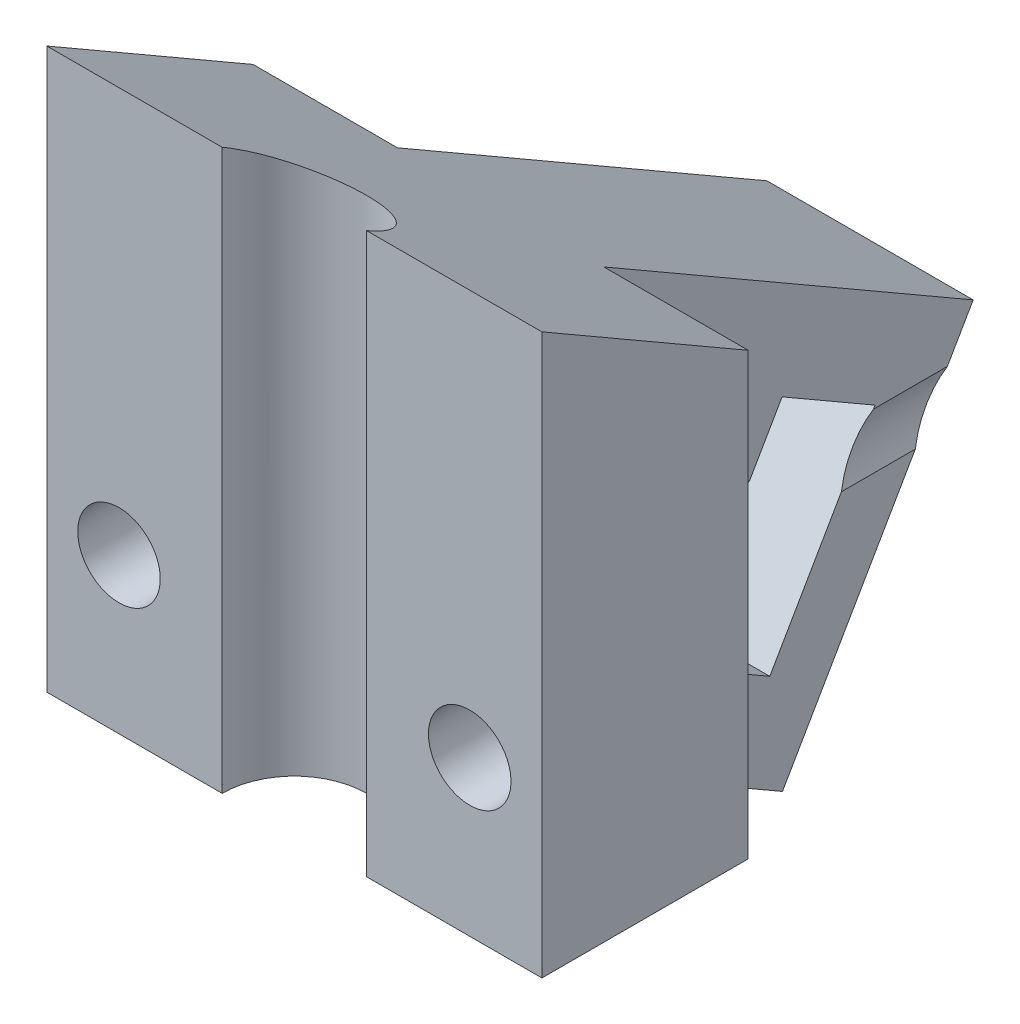
from build123d import *

# Parameters (mm, degrees)
SKETCH_1_W              = 48
SKETCH_1_H              = 20
EXTRUDE_1_DEPTH         = 30
SKETCH_2_W              = 14
SKETCH_2_H              = 30
CUT_EXTRUDE_1_DEPTH     = 7
EXTRUDE_2_DEPTH         = 48
CUT_EXTRUDE_2_DEPTH     = 14
CUT_EXTRUDE_3_DEPTH     = 14
CUT_EXTRUDE_4_DEPTH     = 65.456478054
SKETCH_13_R             = 4
CUT_EXTRUDE_5_DEPTH     = 53.52066051
SKETCH_14_R             = 4
CUT_EXTRUDE_6_DEPTH     = 53.52066051
FILLET_1_R              = 7
EXTRUDE_5_DEPTH         = 1
SKETCH_20_R             = 7.5
CUT_EXTRUDE_8_DEPTH     = 53.52066051
BOSS_EXTRUDE1_DEPTH     = 25
CUT_EXTRUDE1_DEPTH      = 80.244164221
CUT_EXTRUDE1_DEPTH_BACK = 80.244164221


with BuildPart() as part:
    # Эскиз1 → Бобышка-Вытянуть1 (new body)
    with BuildSketch(Plane(origin=(0, 0, 0), x_dir=(1, 0, 0), z_dir=(0, 1, 0))):
        Rectangle(SKETCH_1_W, SKETCH_1_H)
    extrude(amount=EXTRUDE_1_DEPTH)

    # Эскиз2 → Вырез-Вытянуть1 (cut)
    with BuildSketch(Plane.XY.offset(10)):
        with Locations((0, 15)):
            Rectangle(SKETCH_2_W, SKETCH_2_H)
    extrude(amount=-CUT_EXTRUDE_1_DEPTH, mode=Mode.SUBTRACT)

    # Эскиз7 → Бобышка-Вытянуть2 (add)
    with BuildSketch(Plane(origin=(24, 0, 0), x_dir=(0, 0, -1), z_dir=(1, 0, 0))):
        Polygon((10, 0), (27.320508076, -10), (45.810889132, 22.026279442), (32, 30), (10, 30), align=None)
    extrude(amount=-EXTRUDE_2_DEPTH)

    # Эскиз8 → Вырез-Вытянуть2 (cut)
    with BuildSketch(Plane(origin=(24, 0, 0), x_dir=(0, 0, -1), z_dir=(1, 0, 0))):
        Polygon((10, 0), (10, 30), (32, 30), (45.810889132, 22.026279442), (27.320508076, -10), align=None)
    extrude(amount=-CUT_EXTRUDE_2_DEPTH, mode=Mode.SUBTRACT)

    # Эскиз9 → Вырез-Вытянуть3 (cut)
    with BuildSketch(Plane.ZY.offset(24)):
        Polygon((-10, 0), (-10, 30), (-32, 30), (-45.810889132, 22.026279442), (-27.320508076, -10), align=None)
    extrude(amount=-CUT_EXTRUDE_3_DEPTH, mode=Mode.SUBTRACT)

    # Эскиз11 → Вырез-Вытянуть4 (cut, through all)
    with BuildSketch(Plane.ZY.offset(10)):
        Polygon((-17.085266521, 5.482226936), (-27.285266521, 23.149145173), (-36.291930721, 17.949145173), (-26.091930721, 0.282226936), align=None)
    extrude(amount=-CUT_EXTRUDE_4_DEPTH, mode=Mode.SUBTRACT)

    # Эскиз13 → Вырез-Вытянуть5 (cut, through all)
    with BuildSketch(Plane(origin=(0, 0, -10), x_dir=(-1, 0, 0), z_dir=(0, 0, -1))):
        with Locations((17, 15)):
            Circle(SKETCH_13_R)
    extrude(amount=-CUT_EXTRUDE_5_DEPTH, mode=Mode.SUBTRACT)

    # Эскиз14 → Вырез-Вытянуть6 (cut, through all)
    with BuildSketch(Plane(origin=(0, 0, -10), x_dir=(-1, 0, 0), z_dir=(0, 0, -1))):
        with Locations((-17, 15)):
            Circle(SKETCH_14_R)
    extrude(amount=-CUT_EXTRUDE_6_DEPTH, mode=Mode.SUBTRACT)

    # Скругление1
    fillet_1_edges = [part.edges().sort_by_distance(p)[0] for p in [
        (-7, 15, 3),
        (7, 15, 3),
    ]]
    fillet(fillet_1_edges, radius=FILLET_1_R - 0.0001)  # a hair under: the kernel refuses the full size

    # Эскиз18 → Бобышка-Вытянуть5 (add)
    with BuildSketch(Plane(origin=(0, -14.330127019, -24.820508076), x_dir=(-1, 0, 0), z_dir=(0, -0.4999999999999885, -0.8660254037844454))):
        Polygon((2.153846154, 23.490381057), (2.153846154, 15.490381057), (1.025641026, 15.490381057), (1.025641026, 22.567304134), (-2.769230769, 22.567304134), (-2.769230769, 23.490381057), align=None)
    extrude(amount=EXTRUDE_5_DEPTH)

    # Эскиз20 → Вырез-Вытянуть8 (cut, through all)
    with BuildSketch(Plane(origin=(0, 0, -10), x_dir=(-1, 0, 0), z_dir=(0, 0, -1))):
        with Locations((-17, 15)):
            Circle(SKETCH_20_R)
        with Locations((17, 15)):
            Circle(SKETCH_20_R)
    extrude(amount=CUT_EXTRUDE_8_DEPTH, mode=Mode.SUBTRACT)

    # Sketch3 → Boss-Extrude1 (add)
    with BuildSketch(Plane(origin=(0, 30, 0), x_dir=(1, 0, 0), z_dir=(0, 1, 0))):
        with BuildLine():
            Line((7, -10), (24, -10))
            Line((24, -10), (24, 10))
            Line((24, 10), (10, 10))
            Line((10, 10), (10, 32))
            Line((10, 32), (-10, 32))
            Line((-10, 32), (-10, 10))
            Line((-10, 10), (-24, 10))
            Line((-24, 10), (-24, -10))
            Line((-24, -10), (-7, -10))
            ThreePointArc((-7, -10), (0, -3), (7, -10))
        make_face()
    extrude(amount=BOSS_EXTRUDE1_DEPTH)

    # Sketch4 → Cut-Extrude1 (cut, two sides: drawn at the far end of the back side and taken through both)
    with BuildSketch(Plane.ZY.offset(10).offset(-CUT_EXTRUDE1_DEPTH_BACK)):
        Polygon((-251.050138341, -96.468656337), (-45.810889132, 22.026279442), (35.63071017, 69.046608722), (240.869959379, 187.541544501), (3.880087821, 598.020042918), (-488.040009899, 314.00984208), align=None)
    extrude(amount=CUT_EXTRUDE1_DEPTH + CUT_EXTRUDE1_DEPTH_BACK, mode=Mode.SUBTRACT)


solid = part.part
